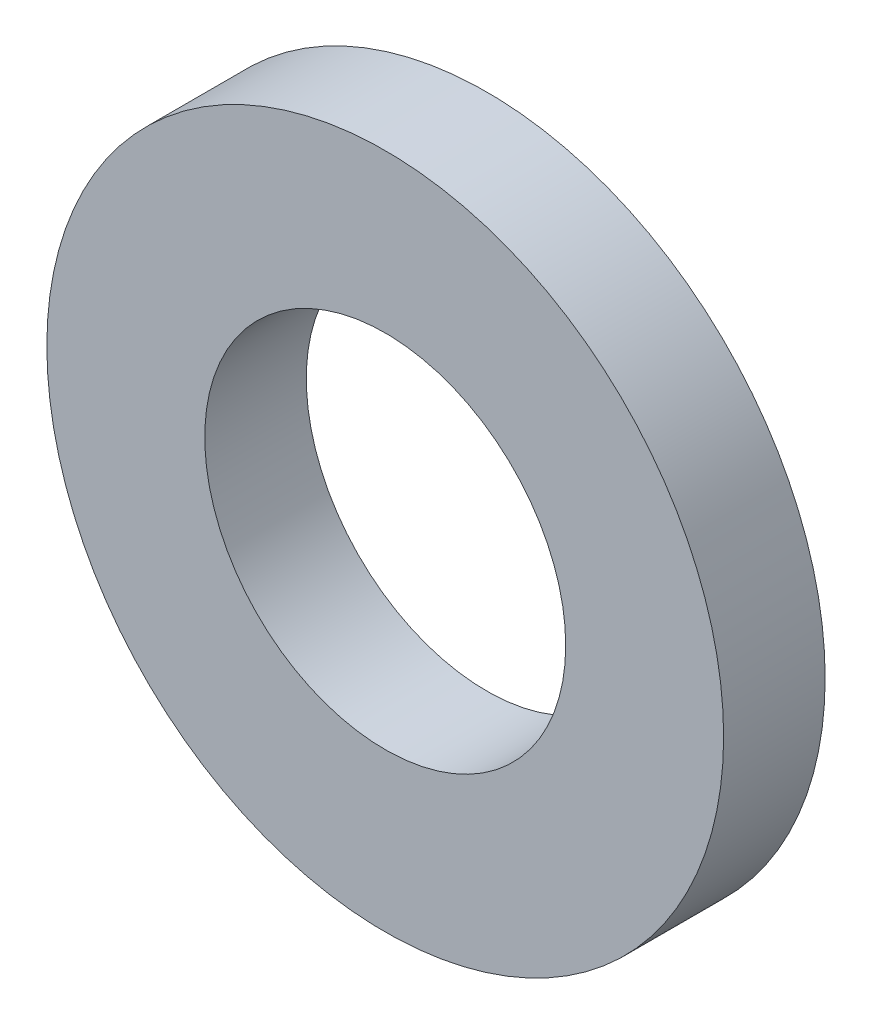
from build123d import *

# Parameters (mm, degrees)
SKETCH1_R           = 6
SKETCH1_R_2         = 3.2
BOSS_EXTRUDE1_DEPTH = 1.8


with BuildPart() as part:
    # Sketch1 → Boss-Extrude1 (new body)
    with BuildSketch(Plane.XY):
        Circle(SKETCH1_R)
        Circle(SKETCH1_R_2, mode=Mode.SUBTRACT)
    extrude(amount=BOSS_EXTRUDE1_DEPTH)


solid = part.part
